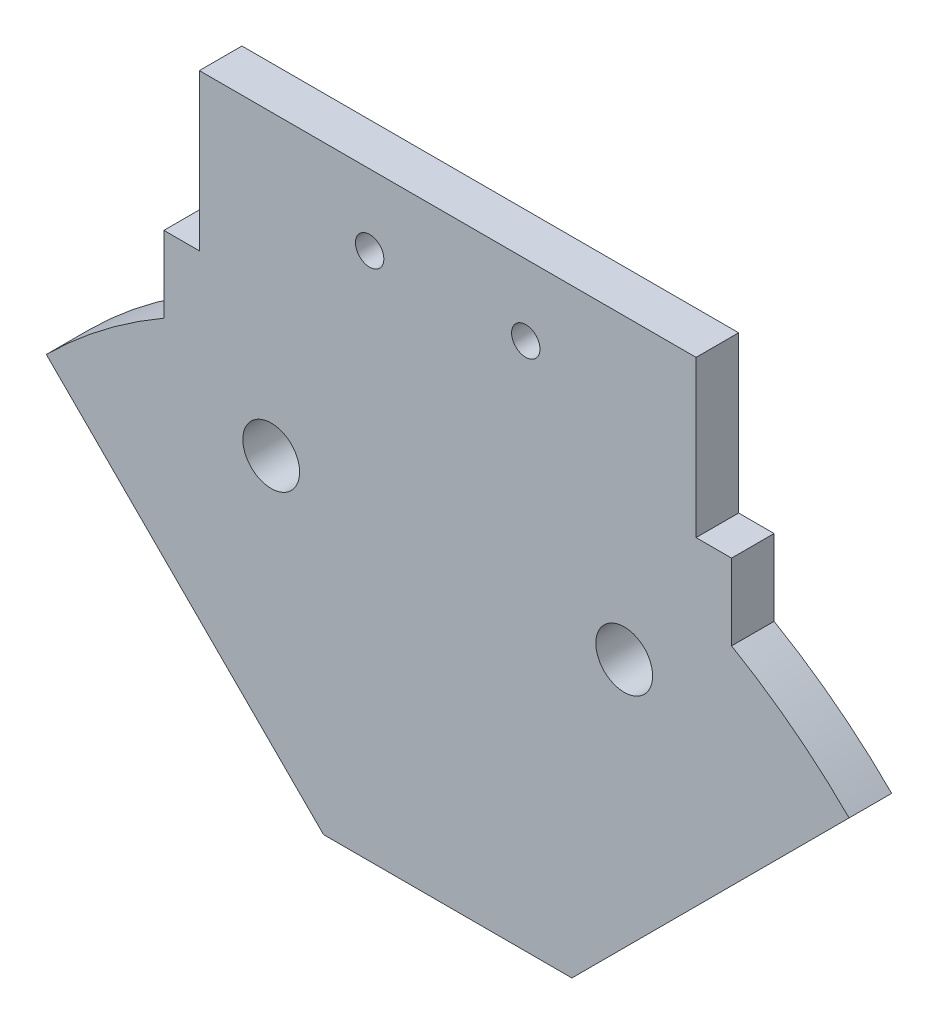
from build123d import *

# Parameters (mm, degrees)
SKETCH1_R           = 4
BOSS_EXTRUDE1_DEPTH = 6
CUT_EXTRUDE1_DEPTH  = 114.296072306
SKETCH3_W           = 80
SKETCH3_H           = 10.717967697
BOSS_EXTRUDE2_DEPTH = 6
SKETCH4_W           = 35
SKETCH4_H           = 5.125631329
CUT_EXTRUDE2_DEPTH  = 99.163129534
SKETCH5_W           = 70
SKETCH5_H           = 6
BOSS_EXTRUDE3_DEPTH = 22
CUT_EXTRUDE3_REACH  = 118.79
SKETCH6_R           = 2


with BuildPart() as part:
    # Sketch1 → Boss-Extrude1 (new body)
    with BuildSketch(Plane.XY):
        with BuildLine():
            Line((-80, 0), (-17.5, 0))
            ThreePointArc((-17.5, 0), (0, 17.5), (17.5, 0))
            Line((17.5, 0), (80, 0))
            ThreePointArc((80, 0), (0, 80), (-80, 0))
        make_face()
        with Locations((24.874423104, 60.052169613)):
            Circle(SKETCH1_R, mode=Mode.SUBTRACT)
        with Locations((60.052169613, 24.874423104)):
            Circle(SKETCH1_R, mode=Mode.SUBTRACT)
        with Locations((-60.052169613, 24.874423104)):
            Circle(SKETCH1_R, mode=Mode.SUBTRACT)
        with Locations((-24.874423104, 60.052169613)):
            Circle(SKETCH1_R, mode=Mode.SUBTRACT)
    extrude(amount=BOSS_EXTRUDE1_DEPTH)

    # Sketch2 → Cut-Extrude1 (cut, through all)
    with BuildSketch(Plane.XY):
        with BuildLine():
            Line((-12.374368671, 12.374368671), (-56.568542495, 56.568542495))
            Line((-56.568542495, 56.568542495), (-80, 56.568542495))
            Line((-80, 56.568542495), (-80, 0))
            Line((-80, 0), (-17.5, 0))
            ThreePointArc((-17.5, 0), (-16.167891819, 6.696960066), (-12.374368671, 12.374368671))
        make_face()
        with BuildLine():
            Line((80, 0), (80, 56.568542495))
            Line((80, 56.568542495), (56.568542495, 56.568542495))
            Line((56.568542495, 56.568542495), (12.374368671, 12.374368671))
            ThreePointArc((12.374368671, 12.374368671), (16.167891819, 6.696960066), (17.5, 0))
            Line((17.5, 0), (80, 0))
        make_face()
    extrude(amount=CUT_EXTRUDE1_DEPTH, mode=Mode.SUBTRACT)

    # Sketch3 → Boss-Extrude2 (add)
    with BuildSketch(Plane.XY):
        with Locations((0, 74.641016151)):
            Rectangle(SKETCH3_W, SKETCH3_H)
    extrude(amount=BOSS_EXTRUDE2_DEPTH)

    # Sketch4 → Cut-Extrude2 (cut, through all)
    with BuildSketch(Plane.XY):
        with Locations((0, 14.937184335)):
            Rectangle(SKETCH4_W, SKETCH4_H)
    extrude(amount=CUT_EXTRUDE2_DEPTH, mode=Mode.SUBTRACT)

    # Sketch5 → Boss-Extrude3 (add)
    with BuildSketch(Plane(origin=(0, 80, 0), x_dir=(1, 0, 0), z_dir=(0, 1, 0))):
        with Locations((0, -3)):
            Rectangle(SKETCH5_W, SKETCH5_H)
    extrude(amount=BOSS_EXTRUDE3_DEPTH)

    # Sketch6 → Cut-Extrude3 (cut, up to next)
    with BuildSketch(Plane(origin=(0, 0, 0), x_dir=(-1, 0, 0), z_dir=(0, 0, -1)), mode=Mode.PRIVATE) as cut_extrude3_sk1:
        with Locations((11, 92)):
            Circle(SKETCH6_R)
    cut_extrude3_tool1 = extrude(cut_extrude3_sk1.sketch, amount=-CUT_EXTRUDE3_REACH, mode=Mode.PRIVATE) & part.part
    # Sketch6 → Cut-Extrude3 (cut, up to next)
    with BuildSketch(Plane(origin=(0, 0, 0), x_dir=(-1, 0, 0), z_dir=(0, 0, -1)), mode=Mode.PRIVATE) as cut_extrude3_sk2:
        with Locations((-11, 92)):
            Circle(SKETCH6_R)
    cut_extrude3_tool2 = extrude(cut_extrude3_sk2.sketch, amount=-CUT_EXTRUDE3_REACH, mode=Mode.PRIVATE) & part.part
    add(cut_extrude3_tool1.solids().sort_by_distance((-11, 92, 0))[0], mode=Mode.SUBTRACT)
    add(cut_extrude3_tool2.solids().sort_by_distance((11, 92, 0))[0], mode=Mode.SUBTRACT)


solid = part.part
